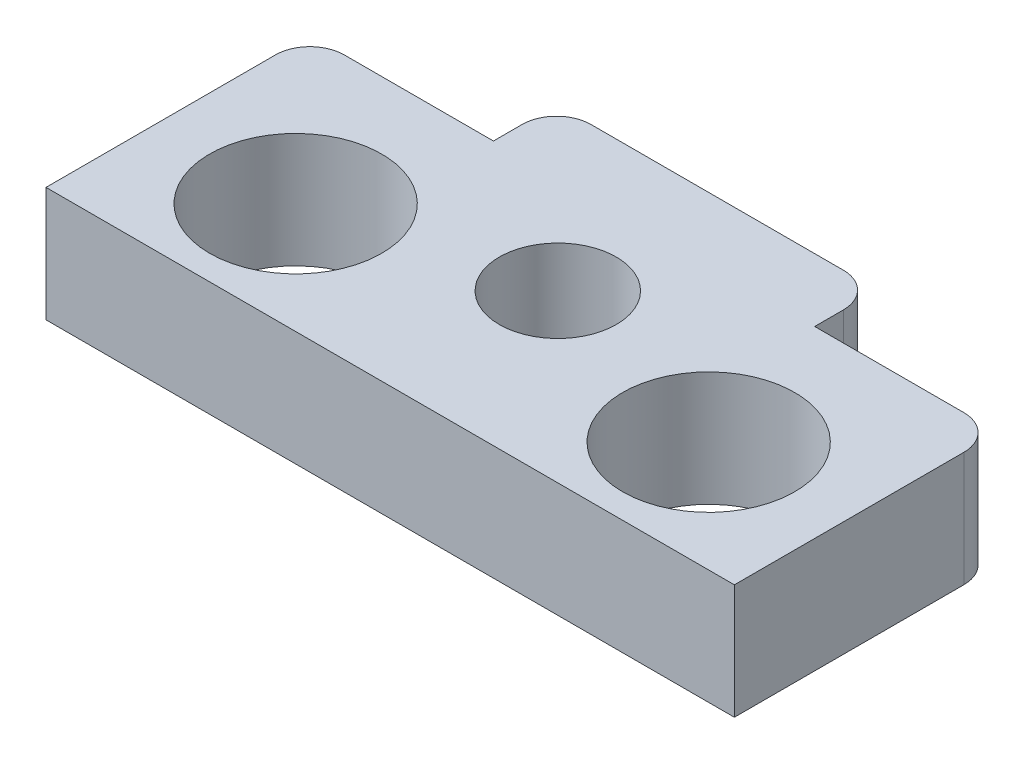
from build123d import *

# Parameters (mm, degrees)
EXTRUDE_1_DEPTH     = 10
FILLET_1_R          = 3
SKETCH_2_R          = 7.5
SKETCH_2_R_2        = 5.1
CUT_EXTRUDE_2_DEPTH = 10


with BuildPart() as part:
    # 草图1 → 凸台-拉伸1 (new body)
    with BuildSketch(Plane(origin=(0, 0, 0), x_dir=(1, 0, 0), z_dir=(0, 1, 0))):
        Polygon((0, 0), (-30, 0), (-30, 23), (-14, 23), (-14, 28.5), (14, 28.5), (14, 23), (30, 23), (30, 0), align=None)
    extrude(amount=EXTRUDE_1_DEPTH)

    # 圆角1
    fillet_1_edges = [part.edges().sort_by_distance(p)[0] for p in [
        (30, 5, -23),
        (14, 5, -28.5),
        (-14, 5, -28.5),
        (-30, 5, -23),
    ]]
    fillet(fillet_1_edges, radius=FILLET_1_R)

    # 草图2 → 切除-拉伸2 (cut)
    with BuildSketch(Plane(origin=(0, 10, 0), x_dir=(1, 0, 0), z_dir=(0, 1, 0))):
        with Locations((18.11016513, 9.65)):
            Circle(SKETCH_2_R)
        with Locations((-17.88983487, 9.65)):
            Circle(SKETCH_2_R)
        with Locations((0.11016513, 14.5)):
            Circle(SKETCH_2_R_2)
    extrude(amount=-CUT_EXTRUDE_2_DEPTH, mode=Mode.SUBTRACT)


solid = part.part
